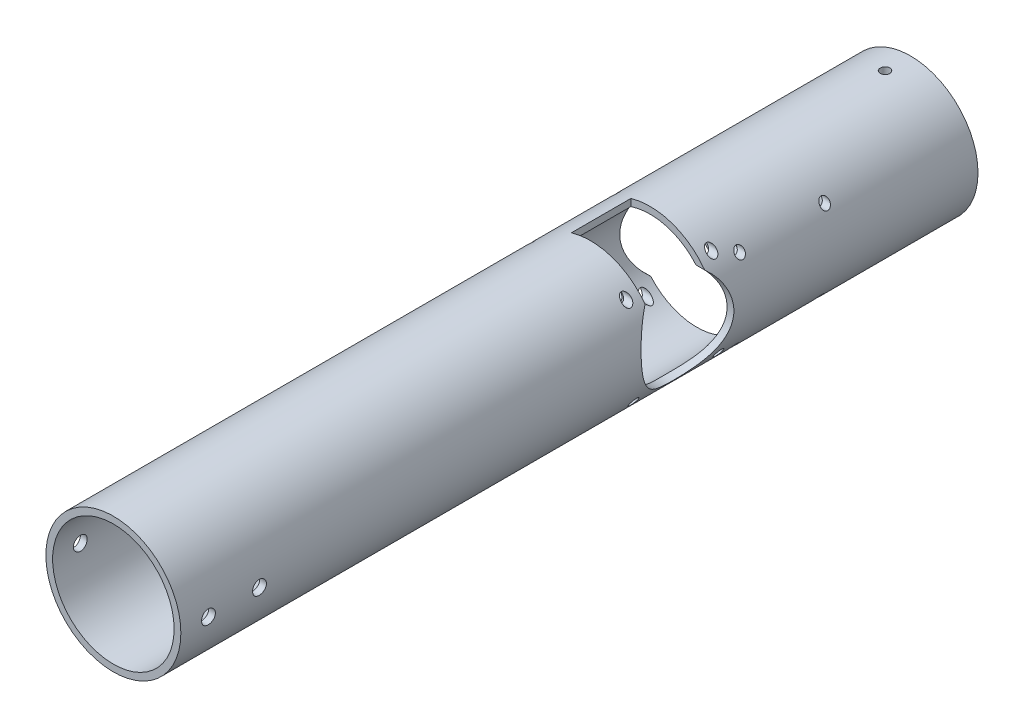
from build123d import *

# Parameters (mm, degrees)
BOSS_EXTRUDE1_DEPTH           = 125
BOSS_EXTRUDE1_DEPTH_BACK      = 250
SKETCH1_R                     = 31.75
SKETCH1_R_2                   = 28.575
SKETCH2_R                     = 21.75
CUT_EXTRUDE1_DEPTH            = 255.000246063
SKETCH3_R                     = 21.75
CUT_EXTRUDE2_DEPTH            = 255.000246186
CUT_EXTRUDE4_START            = 9
SKETCH5_W                     = 28
SKETCH5_H                     = 22
CUT_EXTRUDE4_DEPTH            = 264.000246186
CUT_EXTRUDE5_START            = -9
SKETCH6_W                     = 28
SKETCH6_H                     = 22
CUT_EXTRUDE5_DEPTH            = 264.000246186
CUT_EXTRUDE8_DEPTH            = 255.000246186
CUT_EXTRUDE8_DEPTH_BACK       = 255.000246186
SKETCH11_R                    = 2
CUT_EXTRUDE10_DEPTH           = 255.000246186
CUT_EXTRUDE10_DEPTH_BACK      = 255.000246186
SKETCH12_R                    = 3.25
CUT_EXTRUDE11_DEPTH           = 255.000246186
CUT_EXTRUDE11_DEPTH_BACK      = 255.000246186
SKETCH13_R                    = 2.25
CUT_EXTRUDE12_DEPTH           = 255.000246189
CUT_EXTRUDE12_DEPTH_BACK      = 255.000246189
SKETCH15_R                    = 2
SKETCH19_W                    = 2.25
SKETCH19_H                    = 31.75
M4_CLEARANCE_HOLE1_AT_2_COUNT = 2
M4_CLEARANCE_HOLE1_AT_2_PITCH = 40
M4_CLEARANCE_HOLE1_AT_3_COUNT = 2
M4_CLEARANCE_HOLE1_AT_3_PITCH = 40
M4_CLEARANCE_HOLE1_AT_4_COUNT = 2
M4_CLEARANCE_HOLE1_AT_4_PITCH = 56.568542495
M4_CLEARANCE_HOLE1_AT_5_COUNT = 2
M4_CLEARANCE_HOLE1_AT_5_PITCH = 90.126807577
M4_CLEARANCE_HOLE1_AT_6_COUNT = 2
M4_CLEARANCE_HOLE1_AT_6_PITCH = 50.197623888
M4_CLEARANCE_HOLE1_AT_7_COUNT = 2
M4_CLEARANCE_HOLE1_AT_7_PITCH = 100.213978286
M4_CLEARANCE_HOLE1_AT_8_COUNT = 2
M4_CLEARANCE_HOLE1_AT_8_PITCH = 66.631835064
MIRROR1_COPY_1_SKETCH_W       = 2.25
MIRROR1_COPY_1_SKETCH_H       = 31.75
MIRROR1_COPY_2_SKETCH_W       = 2.25
MIRROR1_COPY_2_SKETCH_H       = 31.75
MIRROR1_COPY_3_SKETCH_W       = 2.25
MIRROR1_COPY_3_SKETCH_H       = 31.75
MIRROR1_COPY_4_SKETCH_W       = 2.25
MIRROR1_COPY_4_SKETCH_H       = 31.75
MIRROR1_COPY_5_SKETCH_W       = 2.25
MIRROR1_COPY_5_SKETCH_H       = 31.75
MIRROR1_COPY_6_SKETCH_W       = 2.25
MIRROR1_COPY_6_SKETCH_H       = 31.75
MIRROR1_COPY_7_SKETCH_W       = 2.25
MIRROR1_COPY_7_SKETCH_H       = 31.75


with BuildPart() as part:
    # Sketch1 → Boss-Extrude1 (new, two sides: drawn at the far end of the back side and taken through both)
    with BuildSketch(Plane.XY.offset(-BOSS_EXTRUDE1_DEPTH_BACK)):
        Circle(SKETCH1_R)
        Circle(SKETCH1_R_2, mode=Mode.SUBTRACT)
    extrude(amount=BOSS_EXTRUDE1_DEPTH + BOSS_EXTRUDE1_DEPTH_BACK)

    # Sketch2 → Cut-Extrude1 (cut, through all)
    with BuildSketch(Plane(origin=(0, 0, 0), x_dir=(0, 0, -1), z_dir=(1, 0, 0))):
        with Locations((163.488, -2)):
            Circle(SKETCH2_R)
    extrude(amount=-CUT_EXTRUDE1_DEPTH, mode=Mode.SUBTRACT)

    # Sketch3 → Cut-Extrude2 (cut, through all)
    with BuildSketch(Plane(origin=(0, 0, 0), x_dir=(0, 0, -1), z_dir=(1, 0, 0))):
        with Locations((113.45, 2)):
            Circle(SKETCH3_R)
    extrude(amount=CUT_EXTRUDE2_DEPTH, mode=Mode.SUBTRACT)

    # Sketch5 → Cut-Extrude4 (cut, through all)
    with BuildSketch(Plane(origin=(0, 0, 0), x_dir=(0, 0, -1), z_dir=(1, 0, 0)).offset(CUT_EXTRUDE4_START)):
        with Locations((163.488, -23.75)):
            Rectangle(SKETCH5_W, SKETCH5_H)
    extrude(amount=-CUT_EXTRUDE4_DEPTH, mode=Mode.SUBTRACT)

    # Sketch6 → Cut-Extrude5 (cut, through all)
    with BuildSketch(Plane(origin=(0, 0, 0), x_dir=(0, 0, -1), z_dir=(1, 0, 0)).offset(CUT_EXTRUDE5_START)):
        with Locations((113.45, 23.75)):
            Rectangle(SKETCH6_W, SKETCH6_H)
    extrude(amount=CUT_EXTRUDE5_DEPTH, mode=Mode.SUBTRACT)

    # Sketch11 → Cut-Extrude8 (cut, two sides: drawn at the far end of the back side and taken through both)
    with BuildSketch(Plane(origin=(0, 0, 0), x_dir=(0, 0, -1), z_dir=(1, 0, 0)).offset(-CUT_EXTRUDE8_DEPTH_BACK)):
        with Locations((183.488, 18)):
            Circle(SKETCH11_R)
        with Locations((143.488, 18)):
            Circle(SKETCH11_R)
        with Locations((143.488, -22)):
            Circle(SKETCH11_R)
        with Locations((183.488, -22)):
            Circle(SKETCH11_R)
    extrude(amount=CUT_EXTRUDE8_DEPTH + CUT_EXTRUDE8_DEPTH_BACK, mode=Mode.SUBTRACT)

    # Sketch12 → Cut-Extrude10 (cut, two sides: drawn at the far end of the back side and taken through both)
    with BuildSketch(Plane(origin=(0, 0, 0), x_dir=(0, 0, -1), z_dir=(1, 0, 0)).offset(-CUT_EXTRUDE10_DEPTH_BACK)):
        with Locations((-112, 0)):
            Circle(SKETCH12_R)
        with Locations((-88, 0)):
            Circle(SKETCH12_R)
    extrude(amount=CUT_EXTRUDE10_DEPTH + CUT_EXTRUDE10_DEPTH_BACK, mode=Mode.SUBTRACT)

    # Sketch13 → Cut-Extrude11 (cut, two sides: drawn at the far end of the back side and taken through both)
    with BuildSketch(Plane(origin=(0, 0, 0), x_dir=(1, 0, 0), z_dir=(0, 1, 0)).offset(-CUT_EXTRUDE11_DEPTH_BACK)):
        with Locations((0, 238)):
            Circle(SKETCH13_R)
    extrude(amount=CUT_EXTRUDE11_DEPTH + CUT_EXTRUDE11_DEPTH_BACK, mode=Mode.SUBTRACT)

    # Sketch15 → Cut-Extrude12 (cut, two sides: drawn at the far end of the back side and taken through both)
    with BuildSketch(Plane(origin=(0, 0, 0), x_dir=(0, 0, -1), z_dir=(1, 0, 0)).offset(-CUT_EXTRUDE12_DEPTH_BACK)):
        with Locations((93.45, 22)):
            Circle(SKETCH15_R)
        with Locations((133.45, 22)):
            Circle(SKETCH15_R)
        with Locations((133.45, -18)):
            Circle(SKETCH15_R)
        with Locations((93.45, -18)):
            Circle(SKETCH15_R)
    extrude(amount=CUT_EXTRUDE12_DEPTH + CUT_EXTRUDE12_DEPTH_BACK, mode=Mode.SUBTRACT)

    # Sketch19 → M4 Clearance Hole1 (revolve, cut)
    with BuildSketch(Plane(origin=(0, 22, -93.45), x_dir=(0, 0, 1), z_dir=(0, 1, 0))):
        with Locations((1.125, 15.875)):
            Rectangle(SKETCH19_W, SKETCH19_H)
    m4_clearance_hole1 = revolve(axis=Axis((-6.35, 22, -93.45), (1, 0, 0)), mode=Mode.SUBTRACT)

    # M4 Clearance Hole1 at 2: M4 Clearance Hole1 ×2
    with Locations(*[(0, 0, -i * M4_CLEARANCE_HOLE1_AT_2_PITCH) for i in range(1, M4_CLEARANCE_HOLE1_AT_2_COUNT)]):
        add(m4_clearance_hole1, mode=Mode.SUBTRACT)

    # M4 Clearance Hole1 at 3: M4 Clearance Hole1 ×2
    with Locations(*[(0, -i * M4_CLEARANCE_HOLE1_AT_3_PITCH, 0) for i in range(1, M4_CLEARANCE_HOLE1_AT_3_COUNT)]):
        add(m4_clearance_hole1, mode=Mode.SUBTRACT)

    # M4 Clearance Hole1 at 4: M4 Clearance Hole1 ×2
    with Locations(*[Vector(0, -0.7071067811865475, -0.7071067811865477) * (i * M4_CLEARANCE_HOLE1_AT_4_PITCH) for i in range(1, M4_CLEARANCE_HOLE1_AT_4_COUNT)]):
        add(m4_clearance_hole1, mode=Mode.SUBTRACT)

    # M4 Clearance Hole1 at 5: M4 Clearance Hole1 ×2
    with Locations(*[Vector(0, -0.04438191152602299, -0.9990146374950151) * (i * M4_CLEARANCE_HOLE1_AT_5_PITCH) for i in range(1, M4_CLEARANCE_HOLE1_AT_5_COUNT)]):
        add(m4_clearance_hole1, mode=Mode.SUBTRACT)

    # M4 Clearance Hole1 at 6: M4 Clearance Hole1 ×2
    with Locations(*[Vector(0, -0.07968504662542596, -0.9968200907607669) * (i * M4_CLEARANCE_HOLE1_AT_6_PITCH) for i in range(1, M4_CLEARANCE_HOLE1_AT_6_COUNT)]):
        add(m4_clearance_hole1, mode=Mode.SUBTRACT)

    # M4 Clearance Hole1 at 7: M4 Clearance Hole1 ×2
    with Locations(*[Vector(0, -0.43906050585303286, -0.8984574960453493) * (i * M4_CLEARANCE_HOLE1_AT_7_PITCH) for i in range(1, M4_CLEARANCE_HOLE1_AT_7_COUNT)]):
        add(m4_clearance_hole1, mode=Mode.SUBTRACT)

    # M4 Clearance Hole1 at 8: M4 Clearance Hole1 ×2
    with Locations(*[Vector(0, -0.6603450131265123, -0.7509623583369186) * (i * M4_CLEARANCE_HOLE1_AT_8_PITCH) for i in range(1, M4_CLEARANCE_HOLE1_AT_8_COUNT)]):
        add(m4_clearance_hole1, mode=Mode.SUBTRACT)

    # Mirror1: M4 Clearance Hole1 across plane
    add(m4_clearance_hole1.mirror(Plane(origin=(0, 0, 0), x_dir=(0, 0, 1), z_dir=(1, 0, 0))), mode=Mode.SUBTRACT)

    # Mirror1 copy 1 sketch → Mirror1 copy 1 (revolve, cut)
    with BuildSketch(Plane(origin=(0, 22, -133.45), x_dir=(0, 0, 1), z_dir=(0, 1, 0))):
        with Locations((1.125, -15.875)):
            Rectangle(MIRROR1_COPY_1_SKETCH_W, MIRROR1_COPY_1_SKETCH_H)
    revolve(axis=Axis((6.35, 22, -133.45), (1, 0, 0)), mode=Mode.SUBTRACT)

    # Mirror1 copy 2 sketch → Mirror1 copy 2 (revolve, cut)
    with BuildSketch(Plane(origin=(0, -18, -93.45), x_dir=(0, 0, 1), z_dir=(0, 1, 0))):
        with Locations((1.125, -15.875)):
            Rectangle(MIRROR1_COPY_2_SKETCH_W, MIRROR1_COPY_2_SKETCH_H)
    revolve(axis=Axis((6.35, -18, -93.45), (1, 0, 0)), mode=Mode.SUBTRACT)

    # Mirror1 copy 3 sketch → Mirror1 copy 3 (revolve, cut)
    with BuildSketch(Plane(origin=(0, -18, -133.45), x_dir=(0, 0, 1), z_dir=(0, 1, 0))):
        with Locations((1.125, -15.875)):
            Rectangle(MIRROR1_COPY_3_SKETCH_W, MIRROR1_COPY_3_SKETCH_H)
    revolve(axis=Axis((6.35, -18, -133.45), (1, 0, 0)), mode=Mode.SUBTRACT)

    # Mirror1 copy 4 sketch → Mirror1 copy 4 (revolve, cut)
    with BuildSketch(Plane(origin=(0, 18, -183.488), x_dir=(0, 0, 1), z_dir=(0, 1, 0))):
        with Locations((1.125, -15.875)):
            Rectangle(MIRROR1_COPY_4_SKETCH_W, MIRROR1_COPY_4_SKETCH_H)
    revolve(axis=Axis((6.35, 18, -183.488), (1, 0, 0)), mode=Mode.SUBTRACT)

    # Mirror1 copy 5 sketch → Mirror1 copy 5 (revolve, cut)
    with BuildSketch(Plane(origin=(0, 18, -143.488), x_dir=(0, 0, 1), z_dir=(0, 1, 0))):
        with Locations((1.125, -15.875)):
            Rectangle(MIRROR1_COPY_5_SKETCH_W, MIRROR1_COPY_5_SKETCH_H)
    revolve(axis=Axis((6.35, 18, -143.488), (1, 0, 0)), mode=Mode.SUBTRACT)

    # Mirror1 copy 6 sketch → Mirror1 copy 6 (revolve, cut)
    with BuildSketch(Plane(origin=(0, -22, -183.488), x_dir=(0, 0, 1), z_dir=(0, 1, 0))):
        with Locations((1.125, -15.875)):
            Rectangle(MIRROR1_COPY_6_SKETCH_W, MIRROR1_COPY_6_SKETCH_H)
    revolve(axis=Axis((6.35, -22, -183.488), (1, 0, 0)), mode=Mode.SUBTRACT)

    # Mirror1 copy 7 sketch → Mirror1 copy 7 (revolve, cut)
    with BuildSketch(Plane(origin=(0, -22, -143.488), x_dir=(0, 0, 1), z_dir=(0, 1, 0))):
        with Locations((1.125, -15.875)):
            Rectangle(MIRROR1_COPY_7_SKETCH_W, MIRROR1_COPY_7_SKETCH_H)
    revolve(axis=Axis((6.35, -22, -143.488), (1, 0, 0)), mode=Mode.SUBTRACT)


solid = part.part
